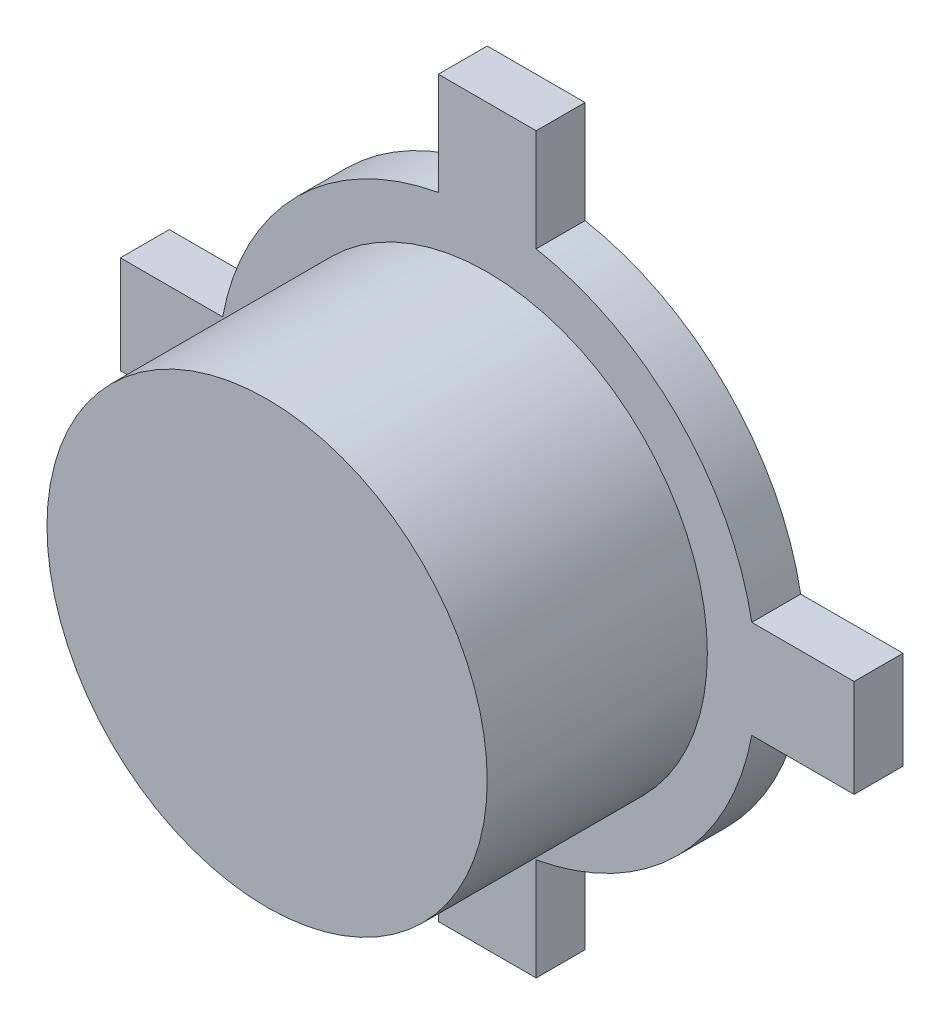
from build123d import *

# Parameters (mm, degrees)
SKETCH1_R           = 4.5
BOSS_EXTRUDE1_DEPTH = 4.5
BOSS_EXTRUDE2_DEPTH = 1


with BuildPart() as part:
    # Sketch1 → Boss-Extrude1 (new body)
    with BuildSketch(Plane.XY):
        Circle(SKETCH1_R)
    extrude(amount=BOSS_EXTRUDE1_DEPTH)

    # Sketch2 → Boss-Extrude2 (add)
    with BuildSketch(Plane(origin=(0, 0, 0), x_dir=(-1, 0, 0), z_dir=(0, 0, -1))):
        with BuildLine():
            Line((-5.408326913, 1), (-7.5, 1))
            Line((-7.5, 1), (-7.5, -1))
            Line((-7.5, -1), (-5.408326913, -1))
            ThreePointArc((-5.408326913, -1), (-3.889087297, -3.889087297), (-1, -5.408326913))
            Line((-1, -5.408326913), (-1, -7.5))
            Line((-1, -7.5), (1, -7.5))
            Line((1, -7.5), (1, -5.408326913))
            ThreePointArc((1, -5.408326913), (3.889087297, -3.889087297), (5.408326913, -1))
            Line((5.408326913, -1), (7.5, -1))
            Line((7.5, -1), (7.5, 1))
            Line((7.5, 1), (5.408326913, 1))
            ThreePointArc((5.408326913, 1), (3.889087297, 3.889087297), (1, 5.408326913))
            Line((1, 5.408326913), (1, 7.5))
            Line((1, 7.5), (-1, 7.5))
            Line((-1, 7.5), (-1, 5.408326913))
            ThreePointArc((-1, 5.408326913), (-3.889087297, 3.889087297), (-5.408326913, 1))
        make_face()
    extrude(amount=BOSS_EXTRUDE2_DEPTH)


solid = part.part
